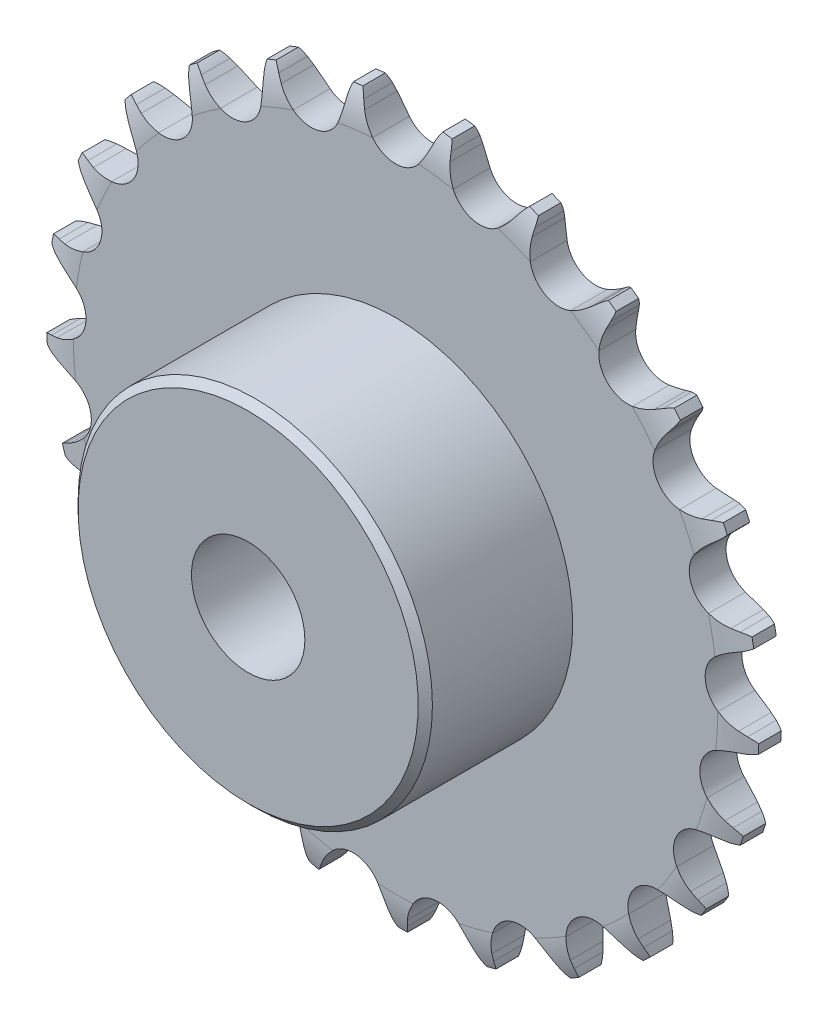
from build123d import *

# Parameters (mm, degrees)
CUT_EXTRUDE1_DEPTH      = 37.152924074
CIRPATTERN1_COUNT       = 25
BOSS_EXTRUDE1_START     = 1.3
SKETCH2_R               = 12.5
BOSS_EXTRUDE1_DEPTH     = 10.4
CUT_EXTRUDE2_DEPTH      = 38.947414766
CUT_EXTRUDE2_DEPTH_BACK = 38.947414766
SKETCH3_R               = 4
SKETCH4_W               = 1.95
SKETCH4_H               = 5.711255998
CUT_EXTRUDE3_DEPTH      = 38.947414766
CUT_EXTRUDE3_DEPTH_BACK = 38.947414766
SKETCH5_OUTSIDE_W       = 67.654
SKETCH5_OUTSIDE_H       = 67.553
SKETCH5_OUTSIDE_R       = 25.15


with BuildPart() as part:
    # Sketch1 → Revolve1 (revolve)
    with BuildSketch(Plane(origin=(0, 0, 0), x_dir=(0, 0, -1), z_dir=(1, 0, 0))):
        with BuildLine():
            Line((1.3, 0), (-1.3, 0))
            Line((-1.3, 0), (-1.3, 22.734973043))
            ThreePointArc((-1.3, 22.734973043), (-1.122370651, 24.184110717), (-0.6, 25.547445265))
            Line((-0.6, 25.547445265), (0.6, 25.547445265))
            ThreePointArc((0.6, 25.547445265), (1.122370651, 24.184110717), (1.3, 22.734973043))
            Line((1.3, 22.734973043), (1.3, 0))
        make_face()
    revolve(axis=Axis((0, 0, -1.3), (0, 0, 1)))

    # Sketch0 → Cut-Extrude1 (cut, symmetric)
    with BuildSketch(Plane.XY):
        with BuildLine():
            Line((5.57304812, -23.924735012), (5.318695539, -23.462833524))
            ThreePointArc((5.318695539, -23.462833524), (4.928220346, -22.856469893), (4.458300545, -22.309365597))
            ThreePointArc((4.458300545, -22.309365597), (2.743305004, -21.715495145), (1.229878778, -22.717210112))
            ThreePointArc((1.229878778, -22.717210112), (0.910781677, -23.363990423), (0.683370483, -24.048411258))
            Line((0.683370483, -24.048411258), (0.551879085, -24.559056175))
            ThreePointArc((0.551879085, -24.559056175), (-0.749226885, -26.4247), (-2.954225291, -26.982808998))
            ThreePointArc((-2.954225291, -26.982808998), (3.402051508, -26.930010657), (9.571764596, -25.400408481))
            ThreePointArc((9.571764596, -25.400408481), (7.297244206, -25.408194308), (5.57304812, -23.924735012))
        make_face()
    cut_extrude1 = extrude(amount=CUT_EXTRUDE1_DEPTH, both=True, mode=Mode.SUBTRACT)

    # CirPattern1: Cut-Extrude1 ×25 about axis
    cirpattern1_axis = Axis((0, 0, 0), (0, 0, 1))
    for i in range(1, CIRPATTERN1_COUNT):
        add(cut_extrude1.rotate(cirpattern1_axis, i * 360 / CIRPATTERN1_COUNT), mode=Mode.SUBTRACT)

    # Sketch2 → Boss-Extrude1 (add)
    with BuildSketch(Plane.XY.offset(BOSS_EXTRUDE1_START)):
        with Locations(Location((0, 0, 0), (0, 0, 270))):
            Circle(SKETCH2_R)
    extrude(amount=BOSS_EXTRUDE1_DEPTH)

    # Sketch3 → Cut-Extrude2 (cut, two sides: drawn at the far end of the back side and taken through both)
    with BuildSketch(Plane.XY.offset(-CUT_EXTRUDE2_DEPTH_BACK)):
        Circle(SKETCH3_R)
    extrude(amount=CUT_EXTRUDE2_DEPTH + CUT_EXTRUDE2_DEPTH_BACK, mode=Mode.SUBTRACT)

    # Sketch4 → Cut-Revolve1 (revolve, cut)
    with BuildSketch(Plane(origin=(0, 0, 0), x_dir=(0, 0, -1), z_dir=(1, 0, 0))):
        Polygon((-11.7, 12.5), (-11.7, 12), (-11.2, 12.5), align=None)
        with Locations((-2.275, 22.691817266)):
            Rectangle(SKETCH4_W, SKETCH4_H)
    revolve(axis=Axis((0, 0, -1.3), (0, 0, 1)), mode=Mode.SUBTRACT)

    # Sketch5 outside → Cut-Extrude3 (cut, two sides: drawn at the far end of the back side and taken through both)
    with BuildSketch(Plane.XY.offset(-CUT_EXTRUDE3_DEPTH_BACK)):
        with Locations((0, -0.0935)):
            Rectangle(SKETCH5_OUTSIDE_W, SKETCH5_OUTSIDE_H)
        Circle(SKETCH5_OUTSIDE_R, mode=Mode.SUBTRACT)
    extrude(amount=CUT_EXTRUDE3_DEPTH + CUT_EXTRUDE3_DEPTH_BACK, mode=Mode.SUBTRACT)


solid = part.part
